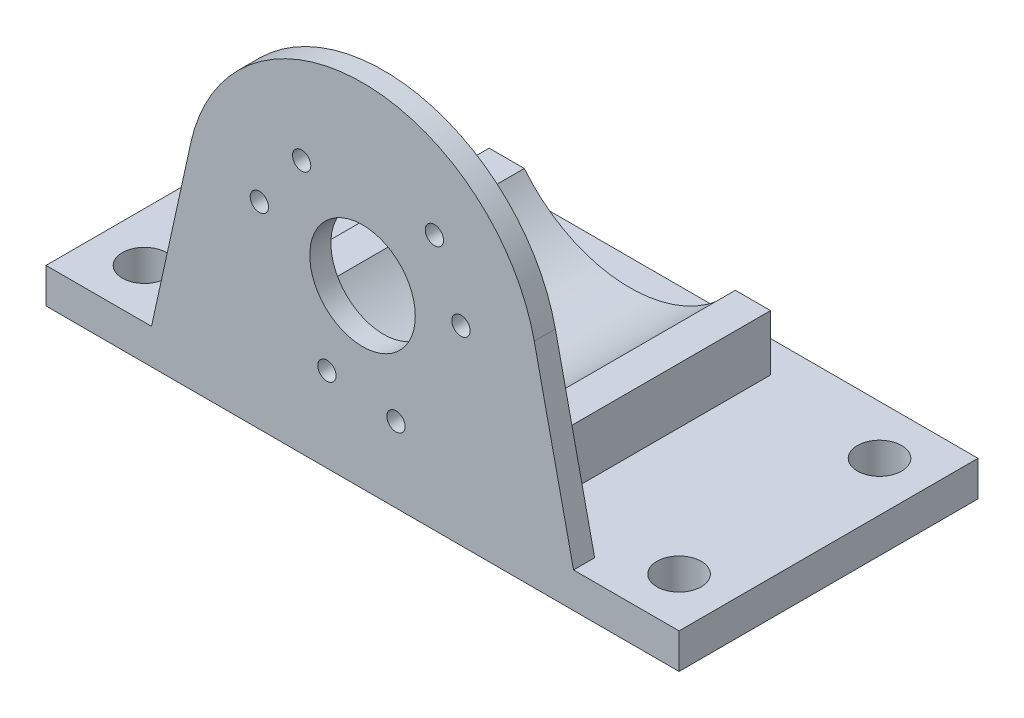
from build123d import *

# Parameters (mm, degrees)
SKETCH3_W           = 90
SKETCH3_H           = 42.5
SKETCH3_R           = 3.15
BOSS_EXTRUDE1_DEPTH = 5
SKETCH4_R           = 1.3
SKETCH4_R_2         = 7.5
BOSS_EXTRUDE2_DEPTH = 3
BOSS_EXTRUDE3_DEPTH = 35


with BuildPart() as part:
    # Sketch3 → Boss-Extrude1 (new body)
    with BuildSketch(Plane(origin=(0, 0, 0), x_dir=(1, 0, 0), z_dir=(0, 1, 0))):
        Rectangle(SKETCH3_W, SKETCH3_H)
        with Locations((-38, 14.25)):
            Circle(SKETCH3_R, mode=Mode.SUBTRACT)
        with Locations((38, 14.25)):
            Circle(SKETCH3_R, mode=Mode.SUBTRACT)
        with Locations((38, -14.25)):
            Circle(SKETCH3_R, mode=Mode.SUBTRACT)
        with Locations((-38, -14.25)):
            Circle(SKETCH3_R, mode=Mode.SUBTRACT)
    extrude(amount=BOSS_EXTRUDE1_DEPTH)

    # Sketch4 → Boss-Extrude2 (add)
    with BuildSketch(Plane.XY.offset(21.25)):
        with BuildLine():
            Line((-30, 5), (30, 5))
            Line((30, 5), (24.415677736, 30.373516604))
            ThreePointArc((24.415677736, 30.373516604), (0, 50), (-24.415677736, 30.373516604))
            Line((-24.415677736, 30.373516604), (-30, 5))
        make_face()
        with Locations((10.21923709, 36.347341968)):
            Circle(SKETCH4_R, mode=Mode.SUBTRACT)
        with Locations((-5.067303705, 12.010919994)):
            Circle(SKETCH4_R, mode=Mode.SUBTRACT)
        with Locations((4.749376983, 10.674714152)):
            Circle(SKETCH4_R, mode=Mode.SUBTRACT)
        with Locations((0, 25)):
            Circle(SKETCH4_R_2, mode=Mode.SUBTRACT)
        with Locations((13.990382911, 27.080076467)):
            Circle(SKETCH4_R, mode=Mode.SUBTRACT)
        with Locations((-14.667309102, 27.992284383)):
            Circle(SKETCH4_R, mode=Mode.SUBTRACT)
        with Locations((-8.654917128, 36.087456884)):
            Circle(SKETCH4_R, mode=Mode.SUBTRACT)
    extrude(amount=-BOSS_EXTRUDE2_DEPTH)

    # Sketch5 → Boss-Extrude3 (add)
    with BuildSketch(Plane(origin=(0, 0, 18.25), x_dir=(-1, 0, 0), z_dir=(0, 0, -1))):
        with BuildLine():
            ThreePointArc((15, 12.935071488), (0, 5.75), (-15, 12.935071488))
            Line((-15, 12.935071488), (-20, 12.935071488))
            Line((-20, 12.935071488), (-20, 5))
            Line((-20, 5), (20, 5))
            Line((20, 5), (20, 12.935071488))
            Line((20, 12.935071488), (15, 12.935071488))
        make_face()
    extrude(amount=BOSS_EXTRUDE3_DEPTH)


solid = part.part
